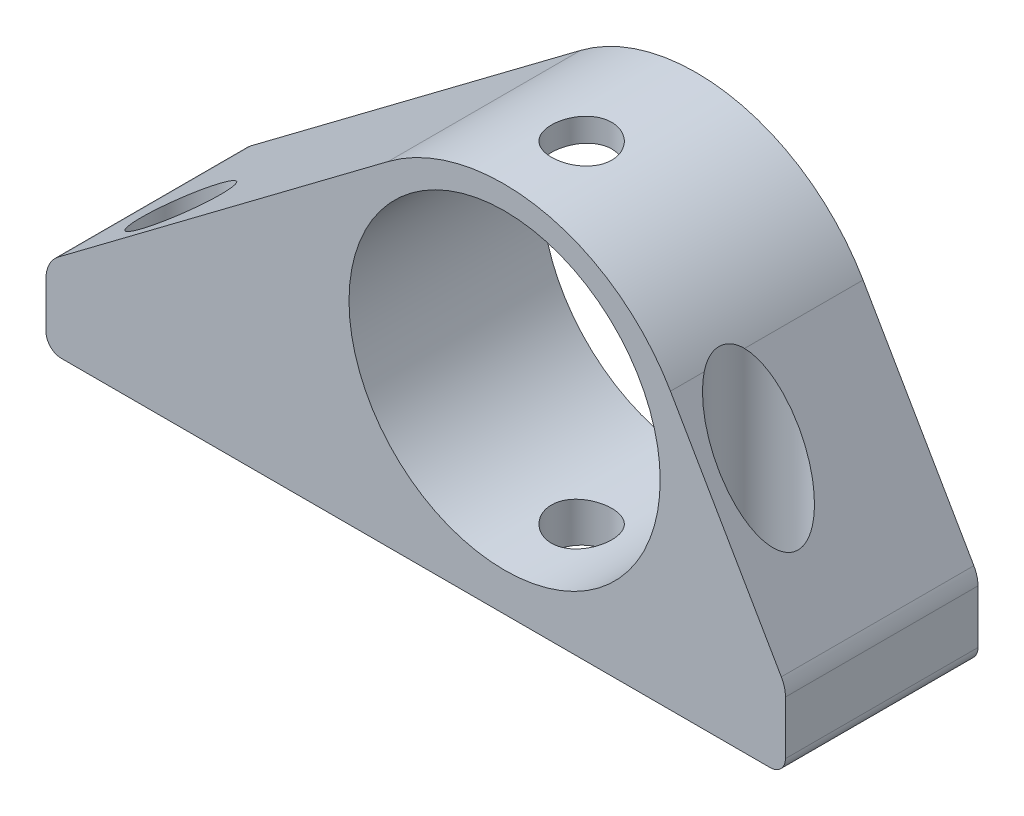
from build123d import *

# Parameters (mm, degrees)
SALIENTE_EXTRUIR1_DEPTH = 15.875
REDONDEO1_R             = 15.875
CORTAR_EXTRUIR1_REACH   = 48.084
CROQUIS2_R              = 9.652
CROQUIS3_R              = 12.827
CORTAR_EXTRUIR2_DEPTH   = 47.084243503
CROQUIS4_R              = 3.2639
CROQUIS4_R_2            = 2.4892
CORTAR_EXTRUIR3_DEPTH   = 47.084243503
REDONDEO2_R             = 2.54
REDONDEO3_R             = 1.27


with BuildPart() as part:
    # Croquis1 → Saliente-Extruir1 (new body)
    with BuildSketch(Plane.XY):
        Polygon((30.48, 0), (-30.48, 0), (-30.48, 6.35), (12.046472996, 38.277805334), (30.48, 6.35), align=None)
    extrude(amount=SALIENTE_EXTRUIR1_DEPTH)

    # Redondeo1
    redondeo1_edges = [part.edges().sort_by_distance(p)[0] for p in [
        (12.046472996, 38.277805334, 7.9375),
    ]]
    fillet(redondeo1_edges, radius=REDONDEO1_R)

    # Croquis2 → Cortar-Extruir1 (cut, up to next)
    with BuildSketch(Plane.XY.offset(15.875), mode=Mode.PRIVATE) as cortar_extruir1_sk1:
        with Locations((7.327326484, 15.97160686)):
            Circle(CROQUIS2_R)
    cortar_extruir1_tool1 = extrude(cortar_extruir1_sk1.sketch, amount=-CORTAR_EXTRUIR1_REACH, mode=Mode.PRIVATE) & part.part
    add(cortar_extruir1_tool1.solids().sort_by_distance((7.327326, 15.971607, 15.875))[0], mode=Mode.SUBTRACT)

    # Croquis3 → Cortar-Extruir2 (cut, through all)
    with BuildSketch(Plane.XY.offset(15.875)):
        with Locations((7.327326484, 15.97160686)):
            Circle(CROQUIS3_R)
    extrude(amount=-CORTAR_EXTRUIR2_DEPTH, mode=Mode.SUBTRACT)

    # Croquis4 → Cortar-Extruir3 (cut, through all)
    with BuildSketch(Plane.XZ):
        with Locations((-23.8125, 11.43)):
            Circle(CROQUIS4_R)
        with Locations((23.8125, 11.43)):
            Circle(CROQUIS4_R)
        with Locations((7.327326484, 9.525)):
            Circle(CROQUIS4_R_2)
    extrude(amount=-CORTAR_EXTRUIR3_DEPTH, mode=Mode.SUBTRACT)

    # Redondeo2
    redondeo2_edges = [part.edges().sort_by_distance(p)[0] for p in [
        (-30.48, 6.35, 7.9375),
        (30.48, 6.35, 7.9375),
    ]]
    fillet(redondeo2_edges, radius=REDONDEO2_R)

    # Redondeo3
    redondeo3_edges = [part.edges().sort_by_distance(p)[0] for p in [
        (30.48, 0, 7.9375),
        (-30.48, 0, 7.9375),
    ]]
    fillet(redondeo3_edges, radius=REDONDEO3_R)


solid = part.part
